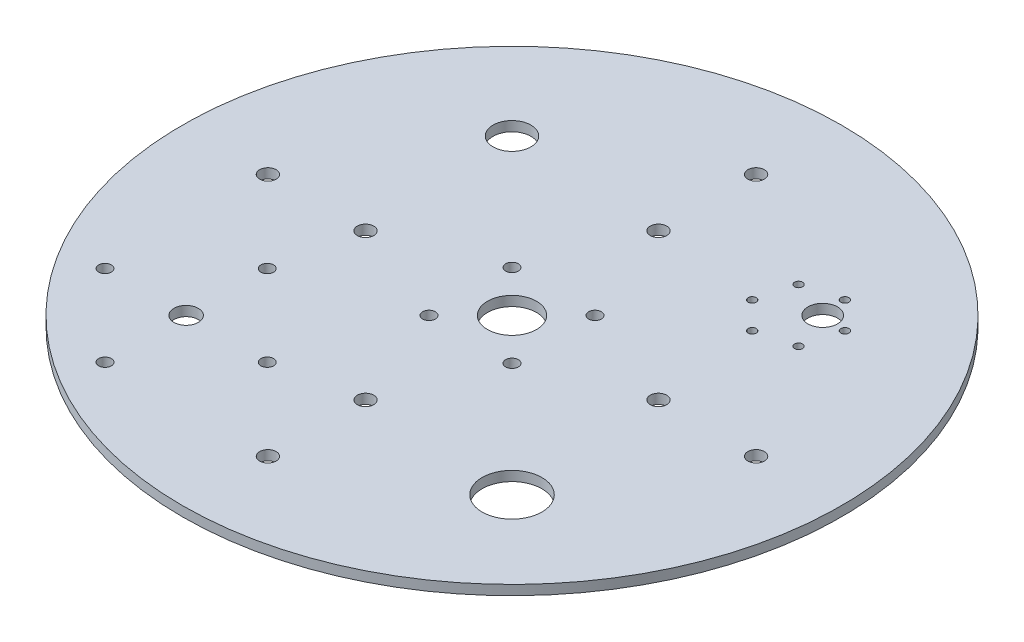
from build123d import *

# Parameters (mm, degrees)
CROQUIS1_R                    = 135
BRIDA_BASE1_DEPTH             = 4
CROQUIS6_R                    = 1.65
CROQUIS6_R_2                  = 6.05
CROQUIS6_R_3                  = 12.25
CROQUIS6_R_4                  = 7.75
CORTAR_EXTRUIR1_DEPTH         = 10
TALADRO_DE_MARGEN_PARA_1_41_D = 6.7564
CROQUIS11_R                   = 10.05
CORTAR_EXTRUIR3_DEPTH         = 10
TALADRO_DE_MARGEN_PARA_M51_D  = 5.2
TALADRO_DE_MARGEN_PARA_M52_D  = 5.2
CROQUIS16_R                   = 5
CORTAR_EXTRUIR4_DEPTH         = 191.960728947


# Sheet-metal steps are written as plain solids
with BuildPart() as part:
    # Croquis1 → Brida base1 (new body)
    with BuildSketch(Plane(origin=(0, 0, 0), x_dir=(1, 0, 0), z_dir=(0, 1, 0))):
        with Locations(Location((0, 0, 0), (0, 0, 270))):
            Circle(CROQUIS1_R)
    extrude(amount=-BRIDA_BASE1_DEPTH)

    # Croquis6 → Cortar-Extruir1 (cut)
    with BuildSketch(Plane(origin=(0, 0, 0), x_dir=(1, 0, 0), z_dir=(0, 1, 0))):
        with Locations(Location((43.718012531, 54.678167639, 0), (0, 0, 270))):
            Circle(CROQUIS6_R)
        with Locations(Location((47.72970773, 69.650017947, 0), (0, 0, 270))):
            Circle(CROQUIS6_R)
        with Locations(Location((63.639610307, 63.639610307, 0), (0, 0, 270))):
            Circle(CROQUIS6_R_2)
        with Locations(Location((63.639610307, -63.639610307, 0), (0, 0, 270))):
            Circle(CROQUIS6_R_3)
        with Locations(Location((-63.639610307, 63.639610307, 0), (0, 0, 270))):
            Circle(CROQUIS6_R_4)
        with Locations(Location((62.701558038, 73.661713146, 0), (0, 0, 270))):
            Circle(CROQUIS6_R)
        with Locations(Location((73.661713146, 62.701558038, 0), (0, 0, 270))):
            Circle(CROQUIS6_R)
        with Locations(Location((69.650017947, 47.72970773, 0), (0, 0, 270))):
            Circle(CROQUIS6_R)
        with Locations(Location((54.678167639, 43.718012531, 0), (0, 0, 270))):
            Circle(CROQUIS6_R)
    extrude(amount=-CORTAR_EXTRUIR1_DEPTH, mode=Mode.SUBTRACT)

    # Taladro de margen para 1/41 (through all)
    with Locations(Plane(origin=(0, 0, 0), x_dir=(1, 0, 0), z_dir=(0, 1, 0))):
        with Locations((100, 0), (60, 0), (0, -100), (0, -60), (-100, 0), (-60, 0), (0, 100), (0, 60), (0, 0)):
            Hole(TALADRO_DE_MARGEN_PARA_1_41_D / 2)

    # Croquis11 → Cortar-Extruir3 (cut)
    with BuildSketch(Plane(origin=(0, 0, 0), x_dir=(1, 0, 0), z_dir=(0, 1, 0))):
        with Locations(Location((0, 0, 0), (0, 0, 270))):
            Circle(CROQUIS11_R)
    extrude(amount=-CORTAR_EXTRUIR3_DEPTH, mode=Mode.SUBTRACT)

    # Taladro de margen para M51 (through all)
    with Locations(Plane(origin=(0, 0, 0), x_dir=(1, 0, 0), z_dir=(0, 1, 0))):
        with Locations((17, 17), (-17, 17), (-17, -17), (17, -17)):
            Hole(TALADRO_DE_MARGEN_PARA_M51_D / 2)

    # Taladro de margen para M52 (through all)
    with Locations(Plane(origin=(0, 0, 0), x_dir=(1, 0, 0), z_dir=(0, 1, 0))):
        with Locations((-33.510619649, -66.744638365), (-66.744638365, -99.97865708), (-99.97865708, -66.744638365), (-66.744638365, -33.510619649), (-66.744638365, -66.744638365)):
            Hole(TALADRO_DE_MARGEN_PARA_M52_D / 2)

    # Croquis16 → Cortar-Extruir4 (cut, through all)
    with BuildSketch(Plane(origin=(0, 0, 0), x_dir=(1, 0, 0), z_dir=(0, 1, 0))):
        with Locations(Location((-66.744638365, -66.744638365, 0), (0, 0, 270))):
            Circle(CROQUIS16_R)
    extrude(amount=-CORTAR_EXTRUIR4_DEPTH, mode=Mode.SUBTRACT)


solid = part.part
